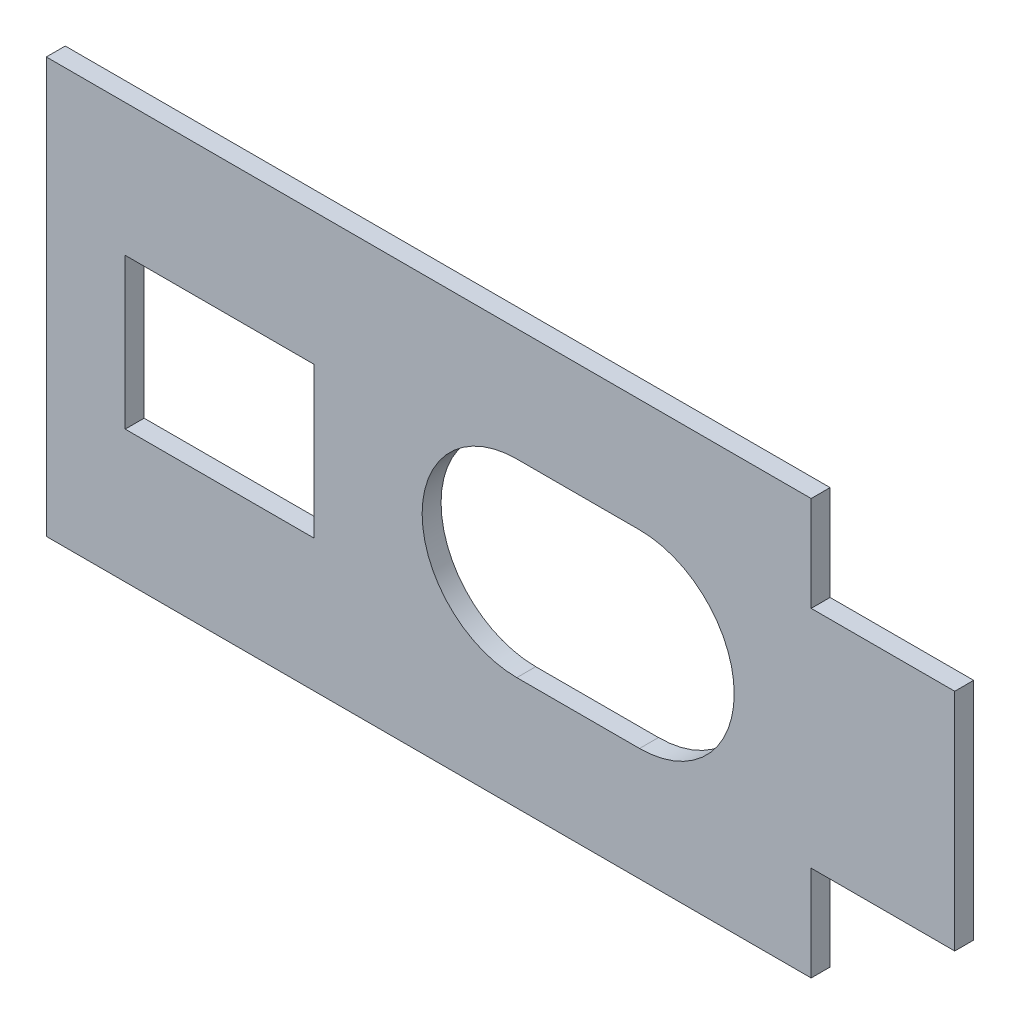
from build123d import *

# Parameters (mm, degrees)
SKETCH1_W           = 7.5946
SKETCH1_H           = 6.0579
BOSS_EXTRUDE2_DEPTH = 0.762


with BuildPart() as part:
    # Sketch1 → Boss-Extrude2 (new body)
    with BuildSketch(Plane.XY.offset(0.762)):
        Polygon((22.109145266, -19.1309), (-8.674277126, -19.1309), (-8.674277126, -35.8441), (22.109145266, -35.8441), (22.109145266, -32.01505), (27.887645266, -32.01505), (27.887645266, -22.95995), (22.109145266, -22.95995), align=None)
        with BuildLine():
            Line((15.201722874, -31.2975), (10.261422874, -31.2975))
            ThreePointArc((10.261422874, -31.2975), (6.451422874, -27.4875), (10.261422874, -23.6775))
            Line((10.261422874, -23.6775), (15.201722874, -23.6775))
            ThreePointArc((15.201722874, -23.6775), (19.011722874, -27.4875), (15.201722874, -31.2975))
        make_face(mode=Mode.SUBTRACT)
        with Locations((-1.701977126, -27.4875)):
            Rectangle(SKETCH1_W, SKETCH1_H, mode=Mode.SUBTRACT)
    extrude(amount=BOSS_EXTRUDE2_DEPTH)


solid = part.part
